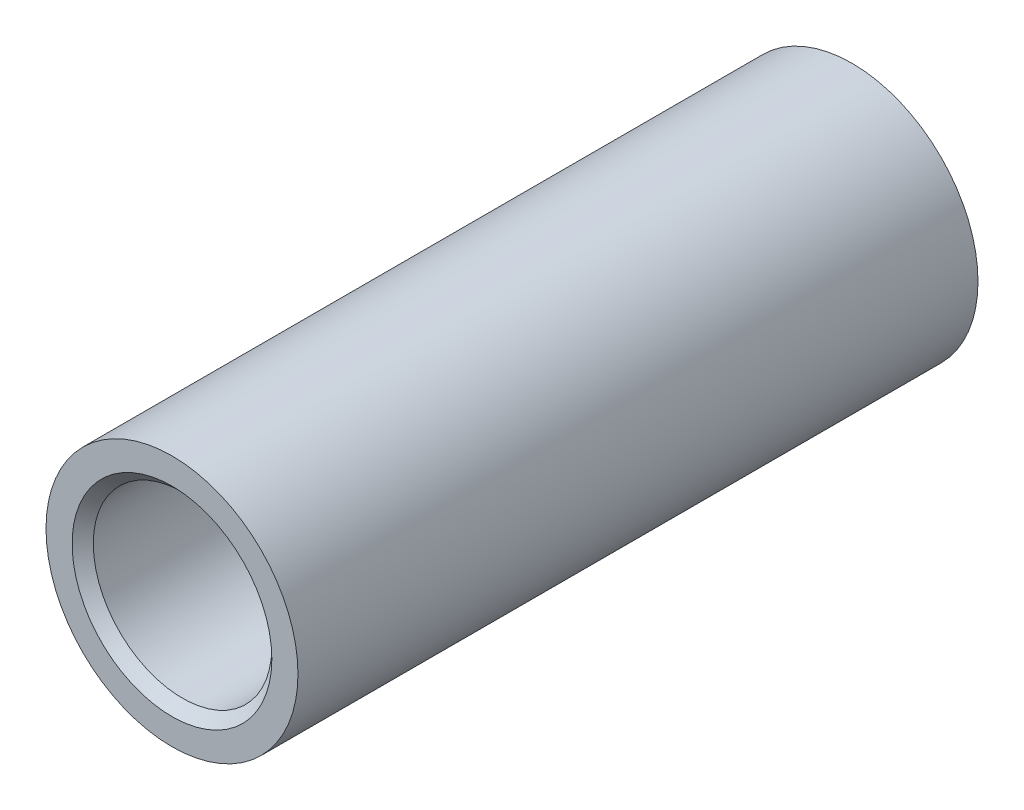
from build123d import *

# Parameters (mm, degrees)
SKETCH1_R           = 4.7625
SKETCH1_R_2         = 3.375
BOSS_EXTRUDE1_DEPTH = 25.708
CHAMFER1_SIZE       = 0.4


with BuildPart() as part:
    # Sketch1 → Boss-Extrude1 (new body)
    with BuildSketch(Plane.XY):
        Circle(SKETCH1_R)
        Circle(SKETCH1_R_2, mode=Mode.SUBTRACT)
    extrude(amount=BOSS_EXTRUDE1_DEPTH)

    # Chamfer1
    chamfer1_edges = [part.edges().sort_by_distance(p)[0] for p in [
        (-3.375, 0, 0),
        (-3.375, 0, 25.708),
    ]]
    chamfer(chamfer1_edges, length=CHAMFER1_SIZE)


solid = part.part
